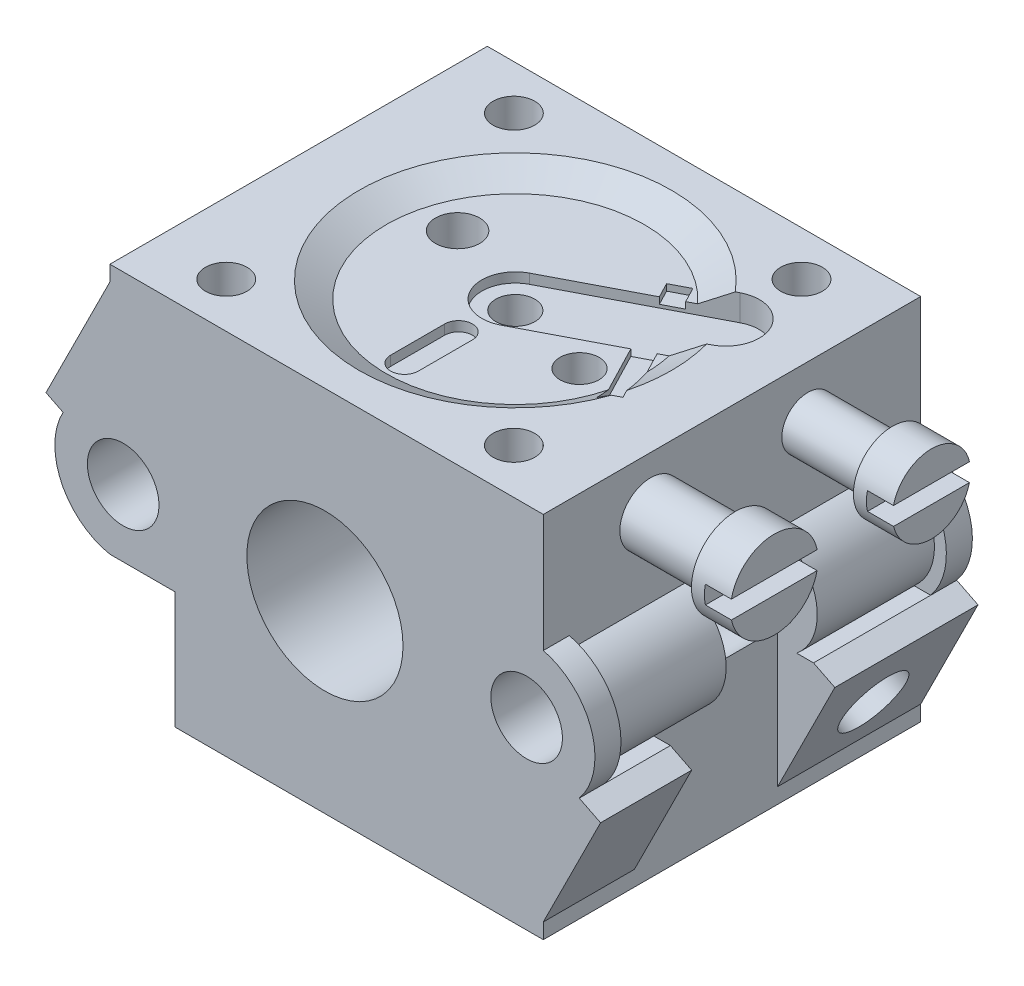
from build123d import *

# Parameters (mm, degrees)
SKETCH1_R                = 6
SKETCH1_R_2              = 2.75
BOSS_EXTRUDE1_DEPTH      = 29
SKETCH2_R                = 1.15
CUT_EXTRUDE1_DEPTH       = 3.3
CUT_EXTRUDE2_DEPTH       = 1.2
SKETCH4_R                = 3.75
CUT_EXTRUDE3_DEPTH       = 5.5
FILLET1_R                = 0.4
CUT_EXTRUDE4_DEPTH       = 9.000001
CUT_EXTRUDE5_DEPTH       = 2
FILLET2_R                = 2
CUT_EXTRUDE6_DEPTH       = 2
CUT_EXTRUDE7_DEPTH       = 6
CUT_EXTRUDE7_DEPTH_BACK  = 2
SKETCH8_R                = 0.6
SKETCH9_R                = 1.75
CUT_EXTRUDE8_DEPTH       = 8
SKETCH10_R               = 1.15
CUT_EXTRUDE9_DEPTH       = 6
CUT_EXTRUDE10_DEPTH      = 16
CUT_EXTRUDE11_DEPTH      = 16
CUT_EXTRUDE11_DEPTH_BACK = 9
SKETCH14_R               = 2.365
SKETCH14_R_2             = 2
BOSS_EXTRUDE2_DEPTH      = 6.5
SKETCH15_R               = 3.365
SKETCH15_R_2             = 3
BOSS_EXTRUDE3_DEPTH      = 3
SKETCH16_W               = 8.507413869
SKETCH16_H               = 1.389544265
SKETCH16_W_2             = 8.620846054
CUT_EXTRUDE12_DEPTH      = 2
SKETCH17_R               = 1.25
CUT_EXTRUDE13_DEPTH      = 5
SKETCH18_R               = 12
CUT_EXTRUDE14_DEPTH      = 1.25
SKETCH19_R               = 1.6
CUT_EXTRUDE15_DEPTH      = 7.2
CHAMFER1_SIZE2           = 2.080349353
CHAMFER1_SIZE            = 1.25
CUT_EXTRUDE16_DEPTH      = 7.2
CUT_EXTRUDE16_DEPTH_BACK = 0.75
SKETCH21_R               = 1.7
SKETCH22_R               = 1.7
SKETCH22_R_2             = 1.5
CUT_EXTRUDE17_DEPTH      = 3
CUT_EXTRUDE18_DEPTH      = 3
CUT_EXTRUDE18_DEPTH_BACK = 0.5
SKETCH24_R               = 1.5
CUT_EXTRUDE19_DEPTH      = 4
SKETCH25_R               = 2.5
CUT_EXTRUDE20_DEPTH      = 54


with BuildPart() as part:
    # Sketch1 → Boss-Extrude1 (new body)
    with BuildSketch(Plane.XY):
        with BuildLine():
            Line((-16.521574992, 14.14825943), (16.778425008, 14.14825943))
            Line((16.778425008, 14.14825943), (16.778425008, 5.089781595))
            ThreePointArc((16.778425008, 5.089781595), (20.487491018, 1.632200563), (19.542258863, -3.349623744))
            Line((19.542258863, -3.349623744), (21.179567545, -4.168278085))
            Line((21.179567545, -4.168278085), (16.778425008, -12.97056316))
            Line((16.778425008, -12.97056316), (16.778425008, -14.15174057))
            Line((16.778425008, -14.15174057), (-16.521574992, -14.15174057))
            Line((-16.521574992, -14.15174057), (-16.521574992, -5.15174057))
            ThreePointArc((-16.521574992, -5.15174057), (-20.251533967, -2.23831219), (-20.121254648, 2.492827861))
            Line((-20.121254648, 2.492827861), (-21.431212587, 3.14780683))
            Line((-21.431212587, 3.14780683), (-16.521574992, 12.96708202))
            Line((-16.521574992, 12.96708202), (-16.521574992, 14.14825943))
        make_face()
        with Locations(Location((0, 0, 0), (0, 0, 180))):
            Circle(SKETCH1_R, mode=Mode.SUBTRACT)
        with Locations(Location((-15.501771089, -0.00174057, 0), (0, 0, 180))):
            Circle(SKETCH1_R_2, mode=Mode.SUBTRACT)
        with Locations(Location((15.498228911, -0.00174057, 0), (0, 0, 180))):
            Circle(SKETCH1_R_2, mode=Mode.SUBTRACT)
    extrude(amount=BOSS_EXTRUDE1_DEPTH)

    # Sketch2 → Cut-Extrude1 (cut)
    with BuildSketch(Plane.XZ.offset(14.15174057)):
        with Locations(Location((-14.021574992, 2.5, 0), (0, 0, 270))):
            Circle(SKETCH2_R)
        with Locations(Location((14.278425008, 26.5, 0), (0, 0, 270))):
            Circle(SKETCH2_R)
    extrude(amount=-CUT_EXTRUDE1_DEPTH, mode=Mode.SUBTRACT)

    # Sketch3 → Cut-Extrude2 (cut)
    with BuildSketch(Plane.XZ.offset(14.15174057)):
        with BuildLine():
            Line((14.778425008, 19.915414543), (14.778425008, 3.039170909))
            ThreePointArc((14.778425008, 3.039170909), (14.485531789, 2.332064128), (13.778425008, 2.039170909))
            Line((13.778425008, 2.039170909), (8.803591633, 2.039170909))
            ThreePointArc((8.803591633, 2.039170909), (8.096484852, 2.332064128), (7.803591633, 3.039170909))
            Line((7.803591633, 3.039170909), (7.803591633, 3.534410473))
            ThreePointArc((7.803591633, 3.534410473), (7.651350698, 4.299777338), (7.217805196, 4.948624035))
            Line((7.217805196, 4.948624035), (4.853844165, 7.312585066))
            ThreePointArc((4.853844165, 7.312585066), (4.420298662, 7.961431763), (4.268057727, 8.726798628))
            Line((4.268057727, 8.726798628), (4.268057727, 16.898371503))
            ThreePointArc((4.268057727, 16.898371503), (4.560950946, 17.605478285), (5.268057727, 17.898371503))
            Line((5.268057727, 17.898371503), (9.048567323, 17.898371503))
            ThreePointArc((9.048567323, 17.898371503), (9.725581746, 18.016443909), (10.322659448, 18.356720033))
            Line((10.322659448, 18.356720033), (13.141378946, 20.686240279))
            ThreePointArc((13.141378946, 20.686240279), (14.204426145, 20.82013717), (14.778425008, 19.915414543))
        make_face()
    extrude(amount=-CUT_EXTRUDE2_DEPTH, mode=Mode.SUBTRACT)

    # Sketch4 → Cut-Extrude3 (cut)
    with BuildSketch(Plane.XZ.offset(12.95174057)):
        with Locations(Location((9.518057727, 11.724139687, 0), (0, 0, 270))):
            Circle(SKETCH4_R)
    extrude(amount=-CUT_EXTRUDE3_DEPTH, mode=Mode.SUBTRACT)

    # Fillet1
    fillet1_edges = [part.edges().sort_by_distance(p)[0] for p in [
        (4.560950946, -12.95174057, 17.605478285),
        (7.158312525, -12.95174057, 17.898371503),
        (9.725581746, -12.95174057, 18.016443909),
        (11.732019197, -12.95174057, 19.521480156),
        (14.204426145, -12.95174057, 20.82013717),
        (14.778425008, -12.95174057, 11.477292726),
        (14.485531789, -12.95174057, 2.332064128),
        (11.291008321, -12.95174057, 2.039170909),
        (8.096484852, -12.95174057, 2.332064128),
        (7.803591633, -12.95174057, 3.286790691),
        (7.651350698, -12.95174057, 4.299777338),
        (6.03582468, -12.95174057, 6.13060455),
        (4.420298662, -12.95174057, 7.961431763),
        (4.268057727, -12.95174057, 12.812585066),
        (9.518057727, -12.95174057, 15.474139687),
    ]]
    fillet(fillet1_edges, radius=FILLET1_R)

    # Sketch5 → Cut-Extrude4 (cut)
    with BuildSketch(Plane.XZ.offset(14.15174057)):
        with BuildLine():
            Line((-11.521574992, 27.651375867), (-11.521574992, 29.701133233))
            Line((-11.521574992, 29.701133233), (-18.111426323, 29.701133233))
            Line((-18.111426323, 29.701133233), (-18.111426323, 11.79877754))
            Line((-18.111426323, 11.79877754), (-16.521574992, 11.79877754))
            add(Edge.make_bspline(
                [(-16.521574992, 11.79877754), (-16.521574992, 15.295873255), (-16.995022666, 21.518018549), (-13.385989412, 26.452401609), (-11.521574992, 27.651375867)],
                knots=[0, 0, 0, 0, 0.621929433, 1, 1, 1, 1], degree=3))
        make_face()
    extrude(amount=-CUT_EXTRUDE4_DEPTH, mode=Mode.SUBTRACT)

    # Sketch6 → Cut-Extrude5 (cut)
    with BuildSketch(Plane.XZ.offset(14.15174057)):
        with BuildLine():
            Line((-14.021574992, 16.854180245), (-14.021574992, 6.15))
            ThreePointArc((-14.021574992, 6.15), (-11.440635241, 5.080939751), (-10.371574992, 2.5))
            Line((-10.371574992, 2.5), (-4.67743828, 2.5))
            Line((-4.67743828, 2.5), (-4.67743828, 6.15))
            Line((-4.67743828, 6.15), (-2.310375311, 9.313007196))
            ThreePointArc((-2.310375311, 9.313007196), (-4.789906471, 13.789787082), (-1.47802893, 17.691209908))
            Line((-1.47802893, 17.691209908), (-1.47802893, 24.44137723))
            ThreePointArc((-1.47802893, 24.44137723), (-3.109739438, 25.020966867), (-4.010219487, 26.5))
            Line((-4.010219487, 26.5), (-8.689981607, 26.5))
            Line((-8.689981607, 26.5), (-10.169344159, 25.548646267))
            add(Edge.make_bspline(
                [(-10.169344159, 25.548646267), (-10.792533734, 25.147883298), (-11.355673029, 24.631639218), (-12.333196467, 23.417620764), (-12.745663818, 22.720322824), (-13.218942907, 21.609098077), (-13.352132255, 21.228654342), (-13.579726814, 20.43190084), (-13.673479019, 20.017450997), (-13.902199837, 18.729487661), (-13.983798711, 17.811127535), (-14.021574992, 16.854180245)],
                knots=[0, 0, 0, 0, 0.25, 0.25, 0.5, 0.5, 0.625, 0.625, 0.75, 0.75, 1, 1, 1, 1], degree=3))
        make_face()
    extrude(amount=-CUT_EXTRUDE5_DEPTH, mode=Mode.SUBTRACT)

    # Fillet2
    fillet2_edges = [part.edges().sort_by_distance(p)[0] for p in [
        (-11.440635241, -12.15174057, 5.080939751),
        (-7.524506636, -12.15174057, 2.5),
        (-4.67743828, -12.15174057, 4.325),
        (-3.493906796, -12.15174057, 7.731503598),
        (-4.789906471, -12.15174057, 13.789787082),
        (-1.47802893, -12.15174057, 21.066293569),
        (-3.109739438, -12.15174057, 25.020966867),
        (-6.350100547, -12.15174057, 26.5),
        (-13.061183211, -12.15174057, 21.979506326),
        (-9.429662883, -12.15174057, 26.024323133),
    ]]
    fillet(fillet2_edges, radius=FILLET2_R - 0.0001)  # a hair under: the kernel refuses the full size

    # Sketch7 → Cut-Extrude6 (cut)
    with BuildSketch(Plane.XZ.offset(12.15174057)):
        Polygon((-1.478008743, 22.269123834), (-1.478008743, 20.068145886), (-4.385228618, 20.880453645), (-4.385228618, 21.456816074), align=None)
        Polygon((-8.066965091, 4.882258972), (-8.066965091, 4.17753736), (-4.67743828, 3.478684793), (-4.67743828, 5.581111539), align=None)
    extrude(amount=CUT_EXTRUDE6_DEPTH, mode=Mode.SUBTRACT)

    # Sketch8 → Cut-Extrude7 (cut, two sides: drawn at the far end of the back side and taken through both)
    with BuildSketch(Plane.ZY.offset(1.478008743).offset(-CUT_EXTRUDE7_DEPTH_BACK)):
        with Locations((4.561082286, -13.15174057)):
            Circle(SKETCH8_R)
        with Locations((21.16863627, -13.15174057)):
            Circle(SKETCH8_R)
    extrude(amount=CUT_EXTRUDE7_DEPTH + CUT_EXTRUDE7_DEPTH_BACK, mode=Mode.SUBTRACT)

    # Sketch9 → Cut-Extrude8 (cut)
    with BuildSketch(Plane.XZ.offset(14.15174057)):
        with Locations(Location((-0.312057245, 13.344863219, 0), (0, 0, 270))):
            Circle(SKETCH9_R)
    extrude(amount=-CUT_EXTRUDE8_DEPTH, mode=Mode.SUBTRACT)

    # Sketch10 → Cut-Extrude9 (cut)
    with BuildSketch(Plane.XZ.offset(14.15174057)):
        with Locations(Location((1.171768986, 4.497047748, 0), (0, 0, 270))):
            Circle(SKETCH10_R)
        with Locations(Location((1.171768986, 8.143444136, 0), (0, 0, 270))):
            Circle(SKETCH10_R)
        with Locations(Location((1.171768986, 21.141082494, 0), (0, 0, 270))):
            Circle(SKETCH10_R)
        with Locations(Location((-1.686217371, 26.736780669, 0), (0, 0, 270))):
            Circle(SKETCH10_R)
        with Locations(Location((6.112249272, 22.63838344, 0), (0, 0, 270))):
            Circle(SKETCH10_R)
    extrude(amount=-CUT_EXTRUDE9_DEPTH, mode=Mode.SUBTRACT)

    # Sketch12 → Cut-Extrude10 (cut)
    with BuildSketch(Plane(origin=(16.778425008, 0, 0), x_dir=(0, 0, -1), z_dir=(1, 0, 0))):
        Polygon((-11, -3.349623744), (-11, 5.089781595), (-18, 5.089781595), (-18, -3.349623744), (-22, -3.349623744), (-22, -12.97056316), (-11, -12.97056316), align=None)
    extrude(amount=CUT_EXTRUDE10_DEPTH, mode=Mode.SUBTRACT)

    # Sketch13 → Cut-Extrude11 (cut, two sides: drawn at the far end of the back side and taken through both)
    with BuildSketch(Plane.XY.offset(11).offset(-CUT_EXTRUDE11_DEPTH_BACK)):
        with BuildLine():
            Line((19.542258863, -3.349623744), (18.24659984, -3.349623744))
            ThreePointArc((18.24659984, -3.349623744), (19.748748046, 0.831896996), (16.778425008, 4.136249578))
            Line((16.778425008, 4.136249578), (16.778425008, 5.089781595))
            ThreePointArc((16.778425008, 5.089781595), (20.487491018, 1.632200563), (19.542258863, -3.349623744))
        make_face()
    extrude(amount=CUT_EXTRUDE11_DEPTH + CUT_EXTRUDE11_DEPTH_BACK, mode=Mode.SUBTRACT)

    # Sketch14 → Boss-Extrude2 (add)
    with BuildSketch(Plane(origin=(16.778425008, 0, 0), x_dir=(0, 0, -1), z_dir=(1, 0, 0))):
        with Locations(Location((-20.752949194, 10.102751897, 0), (0, 0, 270))):
            Circle(SKETCH14_R)
        with Locations(Location((-8.6724215, 10.102751897, 0), (0, 0, 270))):
            Circle(SKETCH14_R_2)
    extrude(amount=BOSS_EXTRUDE2_DEPTH)

    # Sketch15 → Boss-Extrude3 (add)
    with BuildSketch(Plane(origin=(23.278425008, 0, 0), x_dir=(0, 0, -1), z_dir=(1, 0, 0))):
        with Locations(Location((-20.752949194, 10.102751897, 0), (0, 0, 90))):
            Circle(SKETCH15_R)
        with Locations(Location((-8.6724215, 10.102751897, 0), (0, 0, 90))):
            Circle(SKETCH15_R_2)
    extrude(amount=BOSS_EXTRUDE3_DEPTH)

    # Sketch16 → Cut-Extrude12 (cut)
    with BuildSketch(Plane(origin=(26.278425008, 0, 0), x_dir=(0, 0, -1), z_dir=(1, 0, 0))):
        with Locations((-20.838023333, 10.088572875)):
            Rectangle(SKETCH16_W, SKETCH16_H)
        with Locations((-8.303766899, 10.088572875)):
            Rectangle(SKETCH16_W_2, SKETCH16_H)
    extrude(amount=-CUT_EXTRUDE12_DEPTH, mode=Mode.SUBTRACT)

    # Sketch17 → Cut-Extrude13 (cut)
    with BuildSketch(Plane(origin=(0, 0, 0), x_dir=(-1, 0, 0), z_dir=(0, 0, -1))):
        with Locations((0, -10.160085128)):
            Circle(SKETCH17_R)
    extrude(amount=-CUT_EXTRUDE13_DEPTH, mode=Mode.SUBTRACT)

    # Sketch18 → Cut-Extrude14 (cut)
    with BuildSketch(Plane(origin=(0, 14.14825943, 0), x_dir=(1, 0, 0), z_dir=(0, 1, 0))):
        with Locations(Location((0.128425008, -14.5, 0), (0, 0, 180))):
            Circle(SKETCH18_R)
    extrude(amount=-CUT_EXTRUDE14_DEPTH, mode=Mode.SUBTRACT)

    # Sketch19 → Cut-Extrude15 (cut)
    with BuildSketch(Plane(origin=(0, 14.14825943, 0), x_dir=(1, 0, 0), z_dir=(0, 1, 0))):
        with Locations(Location((-11.05, -3.431609331, 0), (0, 0, 180))):
            Circle(SKETCH19_R)
        with Locations(Location((11.05, -3.431609331, 0), (0, 0, 180))):
            Circle(SKETCH19_R)
        with Locations((-11.05, -25.531609331)):
            Circle(SKETCH19_R)
        with Locations((11.05, -25.531609331)):
            Circle(SKETCH19_R)
    extrude(amount=-CUT_EXTRUDE15_DEPTH, mode=Mode.SUBTRACT)

    # Chamfer1
    chamfer1_edges = [part.edges().sort_by_distance(p)[0] for p in [
        (12.128425008, 12.89825943, 14.5),
    ]]
    chamfer1_side = [part.faces().sort_by_distance(p)[0] for p in [
        (12.128425008, 12.92325943, 14.5),
    ]]
    chamfer(chamfer1_edges, length=CHAMFER1_SIZE - 0.0001, length2=CHAMFER1_SIZE2 - 0.0001, reference=chamfer1_side[0])  # a hair under: the kernel refuses the full size

    # Sketch21 → Cut-Extrude16 (cut, two sides: drawn at the far end of the back side and taken through both)
    with BuildSketch(Plane(origin=(0, 12.89825943, 0), x_dir=(1, 0, 0), z_dir=(0, 1, 0)).offset(-CUT_EXTRUDE16_DEPTH_BACK)):
        with Locations(Location((-6.64299376, -12.164384997, 0), (0, 0, 180))):
            Circle(SKETCH21_R)
        with BuildLine():
            Line((-1.056479293, -12.218162038), (9.593275454, -6.687997138))
            ThreePointArc((9.593275454, -6.687997138), (13.060017717, -7.784930799), (11.963084056, -11.251673062))
            Line((11.963084056, -11.251673062), (1.313329309, -16.781837962))
            ThreePointArc((1.313329309, -16.781837962), (-2.153412954, -15.684904301), (-1.056479293, -12.218162038))
        make_face()
        with BuildLine():
            Line((-0.934581351, -23.014879891), (-0.934581351, -18.858588627))
            ThreePointArc((-0.934581351, -18.858588627), (0.128425008, -17.795582268), (1.191431367, -18.858588627))
            Line((1.191431367, -18.858588627), (1.191431367, -23.014879891))
            ThreePointArc((1.191431367, -23.014879891), (0.128425008, -24.07788625), (-0.934581351, -23.014879891))
        make_face()
    extrude(amount=CUT_EXTRUDE16_DEPTH + CUT_EXTRUDE16_DEPTH_BACK, mode=Mode.SUBTRACT)

    # Sketch22 → Cut-Extrude17 (cut)
    with BuildSketch(Plane(origin=(0, 12.14825943, 0), x_dir=(1, 0, 0), z_dir=(0, 1, 0))):
        with Locations(Location((-6.64299376, -12.164384997, 0), (0, 0, 180))):
            Circle(SKETCH22_R)
        with Locations(Location((0.128425008, -14.5, 0), (0, 0, 180))):
            Circle(SKETCH22_R_2)
    extrude(amount=-CUT_EXTRUDE17_DEPTH, mode=Mode.SUBTRACT)

    # Sketch23 → Cut-Extrude18 (cut, two sides: drawn at the far end of the back side and taken through both)
    with BuildSketch(Plane(origin=(0, 12.89825943, 0), x_dir=(1, 0, 0), z_dir=(0, 1, 0)).offset(-CUT_EXTRUDE18_DEPTH_BACK)):
        Polygon((4.909642208, -7.65782599), (10.714980493, -18.837497859), (12.046199837, -18.146227247), (6.240861551, -6.966555378), align=None)
    extrude(amount=CUT_EXTRUDE18_DEPTH + CUT_EXTRUDE18_DEPTH_BACK, mode=Mode.SUBTRACT)

    # Sketch24 → Cut-Extrude19 (cut)
    with BuildSketch(Plane(origin=(0, 12.89825943, 0), x_dir=(1, 0, 0), z_dir=(0, 1, 0))):
        with Locations(Location((7.215415834, -16.654149027, 0), (0, 0, 180))):
            Circle(SKETCH24_R)
    extrude(amount=-CUT_EXTRUDE19_DEPTH, mode=Mode.SUBTRACT)

    # Sketch25 → Cut-Extrude20 (cut)
    with BuildSketch(Plane(origin=(-18.404092801, 9.202046401, 0), x_dir=(0, 0, 1), z_dir=(-0.8944271909999164, 0.44721359549995704, 0))):
        with Locations(Location((5.612927877, 0.303882105, 0), (0, 0, 270))):
            Circle(SKETCH25_R)
    extrude(amount=-CUT_EXTRUDE20_DEPTH, mode=Mode.SUBTRACT)


solid = part.part
